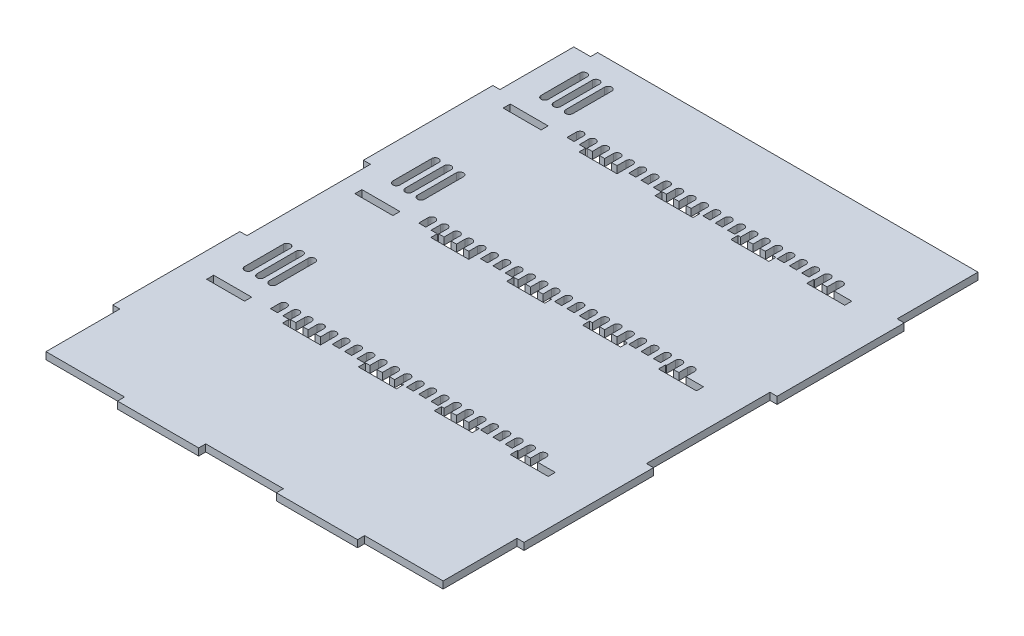
from build123d import *

# Parameters (mm, degrees)
SKETCH1_W           = 233
SKETCH1_H           = 307
BOSS_EXTRUDE1_DEPTH = 4
SKETCH2_W           = 4
SKETCH2_H           = 45.833333333
SKETCH2_W_2         = 44
SKETCH2_H_2         = 4
CUT_EXTRUDE1_DEPTH  = 4
SKETCH3_W           = 21.5
SKETCH3_H           = 4
CUT_EXTRUDE2_DEPTH  = 4
SKETCH4_W           = 4
SKETCH4_H           = 70
CUT_EXTRUDE3_DEPTH  = 4
SKETCH5_W           = 4
SKETCH5_H           = 70
CUT_EXTRUDE4_DEPTH  = 4
CUT_EXTRUDE5_DEPTH  = 4
LPATTERN1_COUNT     = 3
LPATTERN1_PITCH     = 84


with BuildPart() as part:
    # Sketch1 → Boss-Extrude1 (new body)
    with BuildSketch(Plane(origin=(0, 0, 0), x_dir=(1, 0, 0), z_dir=(0, 1, 0))):
        with Locations((116.5, 153.5)):
            Rectangle(SKETCH1_W, SKETCH1_H)
    extrude(amount=BOSS_EXTRUDE1_DEPTH)

    # Sketch2 → Cut-Extrude1 (cut)
    with BuildSketch(Plane(origin=(0, 4, 0), x_dir=(1, 0, 0), z_dir=(0, 1, 0))):
        with Locations((231, 284.083333334)):
            Rectangle(SKETCH2_W, SKETCH2_H)
        Polygon((184.5, 4), (184.5, 0), (233, 0), (233, 45.833333333), (229, 45.833333333), (229, 4), align=None)
        with Locations((116.5, 2)):
            Rectangle(SKETCH2_W_2, SKETCH2_H_2)
        Polygon((4, 45.833333333), (0, 45.833333333), (0, 0), (48.5, 0), (48.5, 4), (4, 4), align=None)
        Polygon((0, 307), (0, 261.166666667), (4, 261.166666667), (4, 303), (13.5, 303), (13.5, 307), align=None)
    extrude(amount=-CUT_EXTRUDE1_DEPTH, mode=Mode.SUBTRACT)

    # Sketch3 → Cut-Extrude2 (cut)
    with BuildSketch(Plane.XZ):
        with Locations((196.75, -255)):
            Rectangle(SKETCH3_W, SKETCH3_H)
        with Locations((153.75, -255)):
            Rectangle(SKETCH3_W, SKETCH3_H)
        with Locations((110.75, -255)):
            Rectangle(SKETCH3_W, SKETCH3_H)
        with Locations((67.75, -255)):
            Rectangle(SKETCH3_W, SKETCH3_H)
        with Locations((24.75, -255)):
            Rectangle(SKETCH3_W, SKETCH3_H)
        with Locations((24.75, -171)):
            Rectangle(SKETCH3_W, SKETCH3_H)
        with Locations((67.75, -171)):
            Rectangle(SKETCH3_W, SKETCH3_H)
        with Locations((110.75, -171)):
            Rectangle(SKETCH3_W, SKETCH3_H)
        with Locations((153.75, -171)):
            Rectangle(SKETCH3_W, SKETCH3_H)
        with Locations((196.75, -171)):
            Rectangle(SKETCH3_W, SKETCH3_H)
        with Locations((24.75, -87)):
            Rectangle(SKETCH3_W, SKETCH3_H)
        with Locations((67.75, -87)):
            Rectangle(SKETCH3_W, SKETCH3_H)
        with Locations((110.75, -87)):
            Rectangle(SKETCH3_W, SKETCH3_H)
        with Locations((153.75, -87)):
            Rectangle(SKETCH3_W, SKETCH3_H)
        with Locations((196.75, -87)):
            Rectangle(SKETCH3_W, SKETCH3_H)
    extrude(amount=-CUT_EXTRUDE2_DEPTH, mode=Mode.SUBTRACT)

    # Sketch4 → Cut-Extrude3 (cut)
    with BuildSketch(Plane(origin=(0, 4, 0), x_dir=(1, 0, 0), z_dir=(0, 1, 0))):
        with Locations((2, 152.833333333)):
            Rectangle(SKETCH4_W, SKETCH4_H)
    extrude(amount=-CUT_EXTRUDE3_DEPTH, mode=Mode.SUBTRACT)

    # Sketch5 → Cut-Extrude4 (cut)
    with BuildSketch(Plane(origin=(0, 4, 0), x_dir=(1, 0, 0), z_dir=(0, 1, 0))):
        with Locations((231, 154.166666667)):
            Rectangle(SKETCH5_W, SKETCH5_H)
    extrude(amount=-CUT_EXTRUDE4_DEPTH, mode=Mode.SUBTRACT)

    # Sketch6 → Cut-Extrude5 (cut)
    with BuildSketch(Plane(origin=(0, 4, 0), x_dir=(1, 0, 0), z_dir=(0, 1, 0))):
        with BuildLine():
            Line((22.5, 292), (22.5, 270))
            ThreePointArc((22.5, 270), (20.5, 268), (18.5, 270))
            Line((18.5, 270), (18.5, 292))
            ThreePointArc((18.5, 292), (20.5, 294), (22.5, 292))
        make_face()
        with BuildLine():
            Line((109.501076108, 256.657930855), (113.501076108, 256.657930855))
            Line((113.501076108, 256.657930855), (113.501076108, 261.998460837))
            ThreePointArc((113.501076108, 261.998460837), (111.501076108, 263.998460837), (109.501076108, 261.998460837))
            Line((109.501076108, 261.998460837), (109.501076108, 256.657930855))
        make_face()
        with BuildLine():
            Line((25.540156573, 292), (25.540156573, 270))
            ThreePointArc((25.540156573, 270), (27.540156573, 268), (29.540156573, 270))
            Line((29.540156573, 270), (29.540156573, 292))
            ThreePointArc((29.540156573, 292), (27.540156573, 294), (25.540156573, 292))
        make_face()
        with BuildLine():
            Line((36.460919536, 292), (36.460919536, 270))
            ThreePointArc((36.460919536, 270), (34.460919536, 268), (32.460919536, 270))
            Line((32.460919536, 270), (32.460919536, 292))
            ThreePointArc((32.460919536, 292), (34.460919536, 294), (36.460919536, 292))
        make_face()
        with BuildLine():
            Line((102.501076108, 261.998460837), (102.501076108, 256.657930855))
            Line((102.501076108, 256.657930855), (106.501076108, 256.657930855))
            Line((106.501076108, 256.657930855), (106.501076108, 261.998460837))
            ThreePointArc((106.501076108, 261.998460837), (104.501076108, 263.998460837), (102.501076108, 261.998460837))
        make_face()
        with BuildLine():
            Line((95.501076108, 261.998460837), (95.501076108, 256.657930855))
            Line((95.501076108, 256.657930855), (99.501076108, 256.657930855))
            Line((99.501076108, 256.657930855), (99.501076108, 261.998460837))
            ThreePointArc((99.501076108, 261.998460837), (97.501076108, 263.998460837), (95.501076108, 261.998460837))
        make_face()
        with BuildLine():
            Line((88.501076108, 261.998460837), (88.501076108, 256.657930855))
            Line((88.501076108, 256.657930855), (92.501076108, 256.657930855))
            Line((92.501076108, 256.657930855), (92.501076108, 261.998460837))
            ThreePointArc((92.501076108, 261.998460837), (90.501076108, 263.998460837), (88.501076108, 261.998460837))
        make_face()
        with BuildLine():
            Line((81.501076108, 261.998460837), (81.501076108, 256.657930855))
            Line((81.501076108, 256.657930855), (85.501076108, 256.657930855))
            Line((85.501076108, 256.657930855), (85.501076108, 261.998460837))
            ThreePointArc((85.501076108, 261.998460837), (83.501076108, 263.998460837), (81.501076108, 261.998460837))
        make_face()
        with BuildLine():
            Line((74.501076108, 261.998460837), (74.501076108, 256.657930855))
            Line((74.501076108, 256.657930855), (78.501076108, 256.657930855))
            Line((78.501076108, 256.657930855), (78.501076108, 261.998460837))
            ThreePointArc((78.501076108, 261.998460837), (76.501076108, 263.998460837), (74.501076108, 261.998460837))
        make_face()
        with BuildLine():
            Line((67.501076108, 261.998460837), (67.501076108, 256.657930855))
            Line((67.501076108, 256.657930855), (71.501076108, 256.657930855))
            Line((71.501076108, 256.657930855), (71.501076108, 261.998460837))
            ThreePointArc((71.501076108, 261.998460837), (69.501076108, 263.998460837), (67.501076108, 261.998460837))
        make_face()
        with BuildLine():
            Line((60.501076108, 261.998460837), (60.501076108, 256.657930855))
            Line((60.501076108, 256.657930855), (64.501076108, 256.657930855))
            Line((64.501076108, 256.657930855), (64.501076108, 261.998460837))
            ThreePointArc((64.501076108, 261.998460837), (62.501076108, 263.998460837), (60.501076108, 261.998460837))
        make_face()
        with BuildLine():
            Line((53.501076108, 261.998460837), (53.501076108, 256.657930855))
            Line((53.501076108, 256.657930855), (57.501076108, 256.657930855))
            Line((57.501076108, 256.657930855), (57.501076108, 261.998460837))
            ThreePointArc((57.501076108, 261.998460837), (55.501076108, 263.998460837), (53.501076108, 261.998460837))
        make_face()
        with BuildLine():
            Line((116.501076108, 261.998460837), (116.501076108, 256.657930855))
            Line((116.501076108, 256.657930855), (120.501076108, 256.657930855))
            Line((120.501076108, 256.657930855), (120.501076108, 261.998460837))
            ThreePointArc((120.501076108, 261.998460837), (118.501076108, 263.998460837), (116.501076108, 261.998460837))
        make_face()
        with BuildLine():
            Line((123.501076108, 261.998460837), (123.501076108, 256.657930855))
            Line((123.501076108, 256.657930855), (127.501076108, 256.657930855))
            Line((127.501076108, 256.657930855), (127.501076108, 261.998460837))
            ThreePointArc((127.501076108, 261.998460837), (125.501076108, 263.998460837), (123.501076108, 261.998460837))
        make_face()
        with BuildLine():
            Line((130.501076108, 261.998460837), (130.501076108, 256.657930855))
            Line((130.501076108, 256.657930855), (134.501076108, 256.657930855))
            Line((134.501076108, 256.657930855), (134.501076108, 261.998460837))
            ThreePointArc((134.501076108, 261.998460837), (132.501076108, 263.998460837), (130.501076108, 261.998460837))
        make_face()
        with BuildLine():
            Line((137.501076108, 261.998460837), (137.501076108, 256.657930855))
            Line((137.501076108, 256.657930855), (141.501076108, 256.657930855))
            Line((141.501076108, 256.657930855), (141.501076108, 261.998460837))
            ThreePointArc((141.501076108, 261.998460837), (139.501076108, 263.998460837), (137.501076108, 261.998460837))
        make_face()
        with BuildLine():
            Line((144.501076108, 261.998460837), (144.501076108, 256.657930855))
            Line((144.501076108, 256.657930855), (148.501076108, 256.657930855))
            Line((148.501076108, 256.657930855), (148.501076108, 261.998460837))
            ThreePointArc((148.501076108, 261.998460837), (146.501076108, 263.998460837), (144.501076108, 261.998460837))
        make_face()
        with BuildLine():
            Line((151.501076108, 261.998460837), (151.501076108, 256.657930855))
            Line((151.501076108, 256.657930855), (155.501076108, 256.657930855))
            Line((155.501076108, 256.657930855), (155.501076108, 261.998460837))
            ThreePointArc((155.501076108, 261.998460837), (153.501076108, 263.998460837), (151.501076108, 261.998460837))
        make_face()
        with BuildLine():
            Line((158.501076108, 261.998460837), (158.501076108, 256.657930855))
            Line((158.501076108, 256.657930855), (162.501076108, 256.657930855))
            Line((162.501076108, 256.657930855), (162.501076108, 261.998460837))
            ThreePointArc((162.501076108, 261.998460837), (160.501076108, 263.998460837), (158.501076108, 261.998460837))
        make_face()
        with BuildLine():
            Line((165.501076108, 261.998460837), (165.501076108, 256.657930855))
            Line((165.501076108, 256.657930855), (169.501076108, 256.657930855))
            Line((169.501076108, 256.657930855), (169.501076108, 261.998460837))
            ThreePointArc((169.501076108, 261.998460837), (167.501076108, 263.998460837), (165.501076108, 261.998460837))
        make_face()
        with BuildLine():
            Line((172.501076108, 261.998460837), (172.501076108, 256.657930855))
            Line((172.501076108, 256.657930855), (176.501076108, 256.657930855))
            Line((176.501076108, 256.657930855), (176.501076108, 261.998460837))
            ThreePointArc((176.501076108, 261.998460837), (174.501076108, 263.998460837), (172.501076108, 261.998460837))
        make_face()
        with BuildLine():
            Line((179.501076108, 261.998460837), (179.501076108, 256.657930855))
            Line((179.501076108, 256.657930855), (183.501076108, 256.657930855))
            Line((183.501076108, 256.657930855), (183.501076108, 261.998460837))
            ThreePointArc((183.501076108, 261.998460837), (181.501076108, 263.998460837), (179.501076108, 261.998460837))
        make_face()
        with BuildLine():
            Line((186.501076108, 261.998460837), (186.501076108, 256.657930855))
            Line((186.501076108, 256.657930855), (190.501076108, 256.657930855))
            Line((190.501076108, 256.657930855), (190.501076108, 261.998460837))
            ThreePointArc((190.501076108, 261.998460837), (188.501076108, 263.998460837), (186.501076108, 261.998460837))
        make_face()
        with BuildLine():
            Line((46.501076108, 261.998460837), (46.501076108, 256.657930855))
            Line((46.501076108, 256.657930855), (50.501076108, 256.657930855))
            Line((50.501076108, 256.657930855), (50.501076108, 261.998460837))
            ThreePointArc((50.501076108, 261.998460837), (48.501076108, 263.998460837), (46.501076108, 261.998460837))
        make_face()
        with BuildLine():
            Line((193.501076108, 261.998460837), (193.501076108, 256.657930855))
            Line((193.501076108, 256.657930855), (197.501076108, 256.657930855))
            Line((197.501076108, 256.657930855), (197.501076108, 261.998460837))
            ThreePointArc((197.501076108, 261.998460837), (195.501076108, 263.998460837), (193.501076108, 261.998460837))
        make_face()
    cut_extrude5 = extrude(amount=-CUT_EXTRUDE5_DEPTH, mode=Mode.SUBTRACT)

    # LPattern1: Cut-Extrude5 ×3
    with Locations(*[(0, 0, i * LPATTERN1_PITCH) for i in range(1, LPATTERN1_COUNT)]):
        add(cut_extrude5, mode=Mode.SUBTRACT)


solid = part.part
